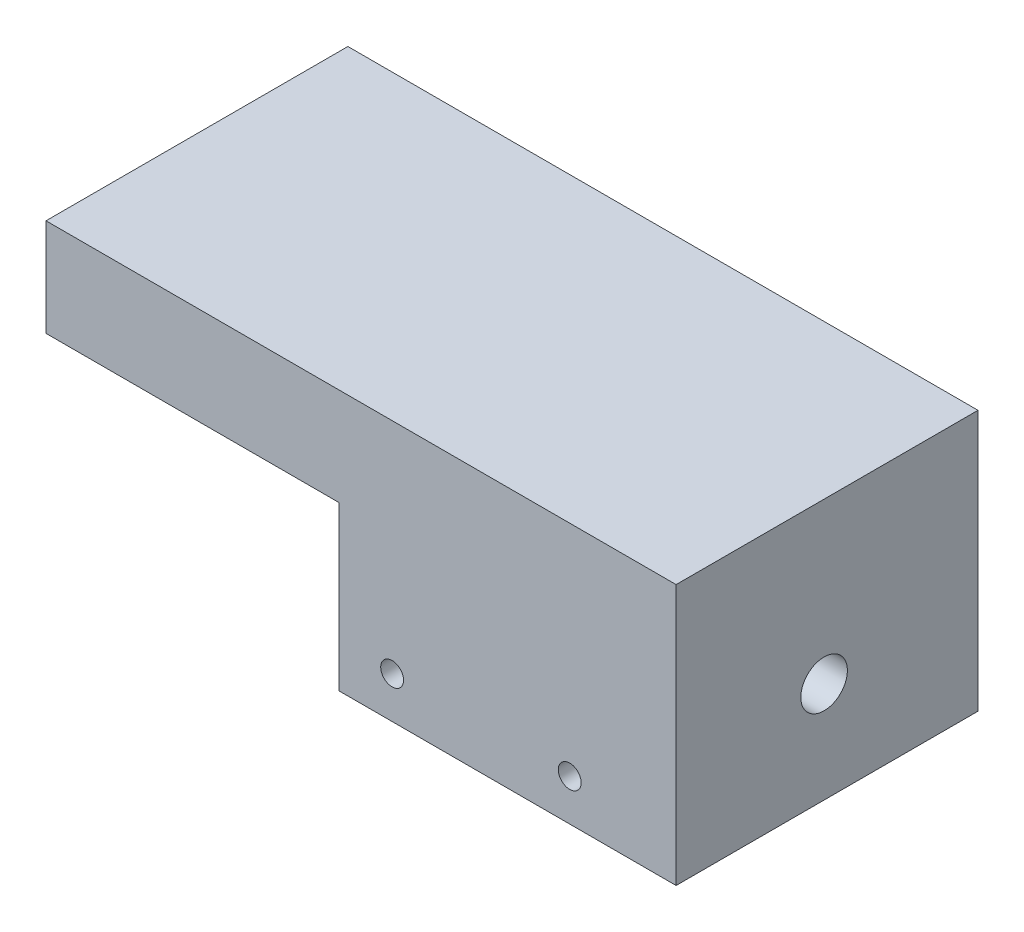
from build123d import *
from build123d.topology import SkipClean

# Parameters (mm, degrees)
SKETCH1_W             = 48
SKETCH1_H             = 53
BOSS_EXTRUDE1_DEPTH   = 10
SKETCH2_W             = 48
SKETCH2_H             = 5.616325
BOSS_EXTRUDE2_DEPTH   = 33.1917878
SKETCH4_W             = 4
SKETCH4_H             = 10
BOSS_EXTRUDE4_DEPTH   = 40
SKETCH5_W             = 48
SKETCH5_H             = 10.8609375
BOSS_EXTRUDE5_DEPTH   = 23.1917878
SKETCH6_W             = 48
SKETCH6_H             = 5
BOSS_EXTRUDE6_DEPTH   = 42.3
SKETCH7_W             = 12.8082122
SKETCH7_H             = 16.4772625
BOSS_EXTRUDE7_DEPTH   = 48
CUT_EXTRUDE1_REACH    = 84.426
SKETCH8_R             = 11.5
SKETCH8_R_2           = 2
FILLET1_R             = 10
FILLET2_R             = 4
SKETCH9_W             = 5
SKETCH9_H             = 16.4772625
BOSS_EXTRUDE9_DEPTH   = 48
CUT_EXTRUDE2_DEPTH    = 88.252507127
SKETCH11_W            = 51
SKETCH11_H            = 16.4772625
BOSS_EXTRUDE10_DEPTH  = 49.45
BOSS_EXTRUDE11_DEPTH  = 46
SKETCH16_W            = 47.95
SKETCH16_H            = 51
BOSS_EXTRUDE14_DEPTH  = 2.55
SKETCH14_W            = 5
SKETCH14_H            = 42.3
BOSS_EXTRUDE13_DEPTH  = 1.5
SKETCH17_W            = 51
SKETCH17_H            = 19.0272625
BOSS_EXTRUDE15_DEPTH  = 9
BOSS_EXTRUDE16_DEPTH  = 25
SKETCH19_R            = 1.9304
CUT_EXTRUDE3_DEPTH    = 125.404890183
MIRROR2_START         = 33.1917878
MIRROR2_DEPTH         = 51
MIRROR2_START_2       = 76.1917878
MIRROR2_2_OUTLINE_W   = 47.95
MIRROR2_2_OUTLINE_H   = 25
MIRROR2_2_OUTLINE_R   = 1.9304
MIRROR2_2_DEPTH       = 8
MIRROR2_3_OUTLINE_W   = 45
MIRROR2_3_OUTLINE_H   = 42.3
MIRROR2_3_OUTLINE_R   = 2
MIRROR2_3_OUTLINE_R_2 = 11.5
MIRROR2_3_DEPTH       = 5
SKETCH20_W            = 103.287975037
SKETCH20_H            = 97.84889924
CUT_EXTRUDE4_DEPTH    = 144.929961559
SKETCH21_W            = 49.5
SKETCH21_H            = 42.3
CUT_EXTRUDE5_DEPTH    = 128.391431036
SKETCH24_R            = 7.5
BOSS_EXTRUDE18_DEPTH  = 45
BOSS_EXTRUDE19_DEPTH  = 29
SKETCH26_R            = 3.937
CUT_EXTRUDE6_DEPTH    = 135.023808387
CUT_EXTRUDE7_DEPTH    = 24
CUT_EXTRUDE8_DEPTH    = 135.852601315
CUT_EXTRUDE9_REACH    = 125.734


# Read off the part's stored shape, not the designer's step: Mirror2
with BuildPart() as part:
    # Sketch1 → Boss-Extrude1 (new body)
    with BuildSketch(Plane.XY):
        with Locations((24, 26.5)):
            Rectangle(SKETCH1_W, SKETCH1_H)
    extrude(amount=BOSS_EXTRUDE1_DEPTH)

    # Sketch2 → Boss-Extrude2 (add)
    with BuildSketch(Plane(origin=(0, 0, 0), x_dir=(-1, 0, 0), z_dir=(0, 0, -1))):
        with Locations((-24, -2.8081625)):
            Rectangle(SKETCH2_W, SKETCH2_H)
    extrude(amount=-BOSS_EXTRUDE2_DEPTH)

    # Sketch4 → Boss-Extrude4 (add)
    with BuildSketch(Plane.XY.offset(10)):
        with Locations((2, 48)):
            Rectangle(SKETCH4_W, SKETCH4_H)
        with Locations((46, 48)):
            Rectangle(SKETCH4_W, SKETCH4_H)
    extrude(amount=BOSS_EXTRUDE4_DEPTH)

    # Sketch5 → Boss-Extrude5 (add)
    with BuildSketch(Plane.XY.offset(10)):
        with Locations((24, 5.43046875)):
            Rectangle(SKETCH5_W, SKETCH5_H)
    extrude(amount=BOSS_EXTRUDE5_DEPTH)

    # Sketch6 → Boss-Extrude6 (add)
    with BuildSketch(Plane.XZ.offset(5.616325)):
        with Locations((24, 30.6917878)):
            Rectangle(SKETCH6_W, SKETCH6_H)
    extrude(amount=BOSS_EXTRUDE6_DEPTH)

    # Sketch7 → Boss-Extrude7 (add)
    with BuildSketch(Plane.ZY):
        with Locations((-6.4041061, 2.62230625)):
            Rectangle(SKETCH7_W, SKETCH7_H)
    extrude(amount=-BOSS_EXTRUDE7_DEPTH)

    # Sketch8 → Cut-Extrude1 (cut, up to next)
    with BuildSketch(Plane(origin=(0, 0, 28.1917878), x_dir=(-1, 0, 0), z_dir=(0, 0, -1)), mode=Mode.PRIVATE) as cut_extrude1_sk1:
        with Locations((-24, -26.616325)):
            Circle(SKETCH8_R)
    cut_extrude1_tool1 = extrude(cut_extrude1_sk1.sketch, amount=-CUT_EXTRUDE1_REACH, mode=Mode.PRIVATE) & part.part
    # Sketch8 → Cut-Extrude1 (cut, up to next)
    with BuildSketch(Plane(origin=(0, 0, 28.1917878), x_dir=(-1, 0, 0), z_dir=(0, 0, -1)), mode=Mode.PRIVATE) as cut_extrude1_sk2:
        with Locations((-39.5, -11.116325)):
            Circle(SKETCH8_R_2)
    cut_extrude1_tool2 = extrude(cut_extrude1_sk2.sketch, amount=-CUT_EXTRUDE1_REACH, mode=Mode.PRIVATE) & part.part
    # Sketch8 → Cut-Extrude1 (cut, up to next)
    with BuildSketch(Plane(origin=(0, 0, 28.1917878), x_dir=(-1, 0, 0), z_dir=(0, 0, -1)), mode=Mode.PRIVATE) as cut_extrude1_sk3:
        with Locations((-39.5, -42.116325)):
            Circle(SKETCH8_R_2)
    cut_extrude1_tool3 = extrude(cut_extrude1_sk3.sketch, amount=-CUT_EXTRUDE1_REACH, mode=Mode.PRIVATE) & part.part
    # Sketch8 → Cut-Extrude1 (cut, up to next)
    with BuildSketch(Plane(origin=(0, 0, 28.1917878), x_dir=(-1, 0, 0), z_dir=(0, 0, -1)), mode=Mode.PRIVATE) as cut_extrude1_sk4:
        with Locations((-8.5, -11.116325)):
            Circle(SKETCH8_R_2)
    cut_extrude1_tool4 = extrude(cut_extrude1_sk4.sketch, amount=-CUT_EXTRUDE1_REACH, mode=Mode.PRIVATE) & part.part
    # Sketch8 → Cut-Extrude1 (cut, up to next)
    with BuildSketch(Plane(origin=(0, 0, 28.1917878), x_dir=(-1, 0, 0), z_dir=(0, 0, -1)), mode=Mode.PRIVATE) as cut_extrude1_sk5:
        with Locations((-8.5, -42.116325)):
            Circle(SKETCH8_R_2)
    cut_extrude1_tool5 = extrude(cut_extrude1_sk5.sketch, amount=-CUT_EXTRUDE1_REACH, mode=Mode.PRIVATE) & part.part
    add(cut_extrude1_tool1.solids().sort_by_distance((24, -26.616325, 28.191788))[0], mode=Mode.SUBTRACT)
    add(cut_extrude1_tool2.solids().sort_by_distance((39.5, -11.116325, 28.191788))[0], mode=Mode.SUBTRACT)
    add(cut_extrude1_tool3.solids().sort_by_distance((39.5, -42.116325, 28.191788))[0], mode=Mode.SUBTRACT)
    add(cut_extrude1_tool4.solids().sort_by_distance((8.5, -11.116325, 28.191788))[0], mode=Mode.SUBTRACT)
    add(cut_extrude1_tool5.solids().sort_by_distance((8.5, -42.116325, 28.191788))[0], mode=Mode.SUBTRACT)

    # Fillet1
    fillet1_edges = [part.edges().sort_by_distance(p)[0] for p in [
        (24, 10.8609375, 0),
    ]]
    fillet(fillet1_edges, radius=FILLET1_R)

    # Fillet2
    fillet2_edges = [part.edges().sort_by_distance(p)[0] for p in [
        (2, 43, 10),
        (46, 43, 10),
    ]]
    fillet(fillet2_edges, radius=FILLET2_R)

    # Sketch9 → Boss-Extrude9 (add)
    with BuildSketch(Plane(origin=(48, 0, 0), x_dir=(0, 0, -1), z_dir=(1, 0, 0))):
        with Locations((15.3082122, 2.62230625)):
            Rectangle(SKETCH9_W, SKETCH9_H)
    extrude(amount=-BOSS_EXTRUDE9_DEPTH)

    # Sketch10 → Cut-Extrude2 (cut, through all)
    with BuildSketch(Plane(origin=(48, 0, 0), x_dir=(0, 0, -1), z_dir=(1, 0, 0))):
        Polygon((17.8082122, 10.8609375), (-33.1917878, 10.8609375), (-76.887145623, 43.902095521), (-50.794096938, 74.436514195), (27.207463492, 71.105486703), align=None)
    extrude(amount=-CUT_EXTRUDE2_DEPTH, mode=Mode.SUBTRACT)

    # Sketch11 → Boss-Extrude10 (add)
    with BuildSketch(Plane(origin=(48, 0, 0), x_dir=(0, 0, -1), z_dir=(1, 0, 0))):
        with Locations((-7.6917878, 2.62230625)):
            Rectangle(SKETCH11_W, SKETCH11_H)
    extrude(amount=BOSS_EXTRUDE10_DEPTH)

    # Sketch12 → Boss-Extrude11 (add)
    with BuildSketch(Plane(origin=(0, 0, 28.1917878), x_dir=(-1, 0, 0), z_dir=(0, 0, -1))):
        Polygon((-48, -47.916325), (-45, -47.916325), (-45, -5.616325), (-49.5, -5.616325), (-49.5, -47.916325), align=None)
    extrude(amount=BOSS_EXTRUDE11_DEPTH)

    # Sketch16 → Boss-Extrude14 (add)
    with BuildSketch(Plane.XZ.offset(5.616325)):
        with Locations((73.475, 7.6917878)):
            Rectangle(SKETCH16_W, SKETCH16_H)
    extrude(amount=BOSS_EXTRUDE14_DEPTH)

    # Sketch14 → Boss-Extrude13 (add)
    with BuildSketch(Plane(origin=(49.5, 0, 0), x_dir=(0, 0, -1), z_dir=(1, 0, 0))):
        with Locations((-30.6917878, -26.766325)):
            Rectangle(SKETCH14_W, SKETCH14_H)
    extrude(amount=-BOSS_EXTRUDE13_DEPTH)

    # Sketch17 → Boss-Extrude15 (add)
    with BuildSketch(Plane(origin=(97.45, 0, 0), x_dir=(0, 0, -1), z_dir=(1, 0, 0))):
        with Locations((-7.6917878, 1.34730625)):
            Rectangle(SKETCH17_W, SKETCH17_H)
    extrude(amount=BOSS_EXTRUDE15_DEPTH)

    # Sketch18 → Boss-Extrude16 (add)
    with BuildSketch(Plane.XZ.offset(8.166325)):
        Polygon((49.5, -17.8082122), (106.45, -17.8082122), (106.45, -9.8082122), (106.45, 33.1917878), (97.45, 33.1917878), (97.45, -9.8082122), (49.5, -9.8082122), align=None)
    extrude(amount=BOSS_EXTRUDE16_DEPTH)

    # Sketch19 → Cut-Extrude3 (cut, through all)
    with BuildSketch(Plane.XY.offset(-9.8082122)):
        with Locations((58.475, -26.166325)):
            Circle(SKETCH19_R)
        with Locations((88.475, -26.166325)):
            Circle(SKETCH19_R)
    extrude(amount=-CUT_EXTRUDE3_DEPTH, mode=Mode.SUBTRACT)

    # Mirror2 outline → Mirror2 (add)
    with BuildSketch(Plane.XY.offset(MIRROR2_START)):
        Polygon((49.5, -47.916325), (49.5, -8.166325), (97.45, -8.166325), (97.45, -33.166325), (106.45, -33.166325), (106.45, 10.8609375), (0, 10.8609375), (0, -5.616325), (45, -5.616325), (45, -47.916325), align=None)
    extrude(amount=MIRROR2_DEPTH)

    # Mirror2 2 outline → Mirror2 2 (add)
    with BuildSketch(Plane.XY.offset(MIRROR2_START_2)):
        with Locations((73.475, -20.666325)):
            Rectangle(MIRROR2_2_OUTLINE_W, MIRROR2_2_OUTLINE_H)
        with Locations((58.475, -26.166325)):
            Circle(MIRROR2_2_OUTLINE_R, mode=Mode.SUBTRACT)
        with Locations((88.475, -26.166325)):
            Circle(MIRROR2_2_OUTLINE_R, mode=Mode.SUBTRACT)
    extrude(amount=MIRROR2_2_DEPTH)

    # Mirror2 3 outline → Mirror2 3 (add)
    with SkipClean():  # the faces are left unmerged after this step: merging them gives an invalid solid
        with BuildSketch(Plane.XY.offset(MIRROR2_START)):
            with Locations((22.5, -26.766325)):
                Rectangle(MIRROR2_3_OUTLINE_W, MIRROR2_3_OUTLINE_H)
            with Locations((8.5, -42.116325)):
                Circle(MIRROR2_3_OUTLINE_R, mode=Mode.SUBTRACT)
            with Locations((39.5, -42.116325)):
                Circle(MIRROR2_3_OUTLINE_R, mode=Mode.SUBTRACT)
            with Locations((24, -26.616325)):
                Circle(MIRROR2_3_OUTLINE_R_2, mode=Mode.SUBTRACT)
            with Locations((8.5, -11.116325)):
                Circle(MIRROR2_3_OUTLINE_R, mode=Mode.SUBTRACT)
            with Locations((39.5, -11.116325)):
                Circle(MIRROR2_3_OUTLINE_R, mode=Mode.SUBTRACT)
        extrude(amount=MIRROR2_3_DEPTH)

    # Sketch20 → Cut-Extrude4 (cut, through all)
    with BuildSketch(Plane.ZY):
        with Locations((-18.452199719, -38.06351212)):
            Rectangle(SKETCH20_W, SKETCH20_H)
    extrude(amount=-CUT_EXTRUDE4_DEPTH, mode=Mode.SUBTRACT)

    # Sketch21 → Cut-Extrude5 (cut, through all)
    with BuildSketch(Plane.XY.offset(84.1917878)):
        with Locations((24.75, -26.766325)):
            Rectangle(SKETCH21_W, SKETCH21_H)
    extrude(amount=-CUT_EXTRUDE5_DEPTH, mode=Mode.SUBTRACT)



with BuildPart() as body_2:
    # Sketch24 → Boss-Extrude18 (new body)
    with BuildSketch(Plane.XY.offset(55.1917878)):
        with Locations((24, -29.616325)):
            Circle(SKETCH24_R)
    extrude(amount=-BOSS_EXTRUDE18_DEPTH)


with BuildPart() as part_1:
    add(part.part)

    add(body_2.part)  # Boss-Extrude19 merges body 2
    # Sketch25 → Boss-Extrude19 (add)
    with BuildSketch(Plane.XY.offset(55.1917878)):
        with BuildLine():
            Line((16.5, -29.616325), (12.268152463, -5.616325))
            Line((12.268152463, -5.616325), (35.731847537, -5.616325))
            Line((35.731847537, -5.616325), (31.5, -29.616325))
            ThreePointArc((31.5, -29.616325), (24, -37.116325), (16.5, -29.616325))
        make_face()
    extrude(amount=BOSS_EXTRUDE19_DEPTH)

    # Sketch26 → Cut-Extrude6 (cut, through all)
    with BuildSketch(Plane.ZY.offset(-97.45)):
        with Locations((59.1917878, -16.166325)):
            Circle(SKETCH26_R)
    extrude(amount=-CUT_EXTRUDE6_DEPTH, mode=Mode.SUBTRACT)

    # Sketch27 → Cut-Extrude7 (cut)
    with BuildSketch(Plane.XY.offset(79.1917878)):
        Polygon((12.268152463, -5.616325), (12.268152463, 5.8609375), (35.731847537, 5.8609375), (35.731847537, -5.616325), (35.731847537, -46.734959709), (12.268152463, -46.734959709), align=None)
    extrude(amount=-CUT_EXTRUDE7_DEPTH, mode=Mode.SUBTRACT)


with BuildPart() as cut_extrude7_piece_1:
    # of the separate pieces the step leaves, piece 1, a body of its own (cut_extrude7_pieces)
    add(part_1.part.solids().sort_by_distance((97.45, -8.166325, 33.1917878))[0])

    # Sketch29 → Cut-Extrude9 (cut, up to next)
    with BuildSketch(Plane.XY.offset(84.1917878), mode=Mode.PRIVATE) as cut_extrude9_sk1:
        with BuildLine():
            Line((12.268152463, -5.616325), (35.731847537, -5.616325))
            Line((35.731847537, -5.616325), (31.5, -29.616325))
            ThreePointArc((31.5, -29.616325), (24, -37.116325), (16.5, -29.616325))
            Line((16.5, -29.616325), (12.268152463, -5.616325))
        make_face()
    cut_extrude9_tool1 = extrude(cut_extrude9_sk1.sketch, amount=-CUT_EXTRUDE9_REACH, mode=Mode.PRIVATE) & cut_extrude7_piece_1.part
    add(cut_extrude9_tool1.solids().sort_by_distance((24, -19.317077, 84.191788))[0], mode=Mode.SUBTRACT)


with BuildPart() as cut_extrude7_piece_2:
    # of the separate pieces the step leaves, piece 2, a body of its own (cut_extrude7_pieces)
    add(part_1.part.solids().sort_by_distance((31.5, -29.616325, 55.1917878))[0])

    # Sketch28 → Cut-Extrude8 (cut, through all)
    with BuildSketch(Plane(origin=(0, 0, 10.1917878), x_dir=(-1, 0, 0), z_dir=(0, 0, -1))):
        with BuildLine():
            Line((-31.5, -29.616325), (-35.731847537, -5.616325))
            Line((-35.731847537, -5.616325), (-12.268152463, -5.616325))
            Line((-12.268152463, -5.616325), (-16.5, -29.616325))
            ThreePointArc((-16.5, -29.616325), (-24, -37.116325), (-31.5, -29.616325))
        make_face()
    extrude(amount=-CUT_EXTRUDE8_DEPTH, mode=Mode.SUBTRACT)


solid = cut_extrude7_piece_1.part
